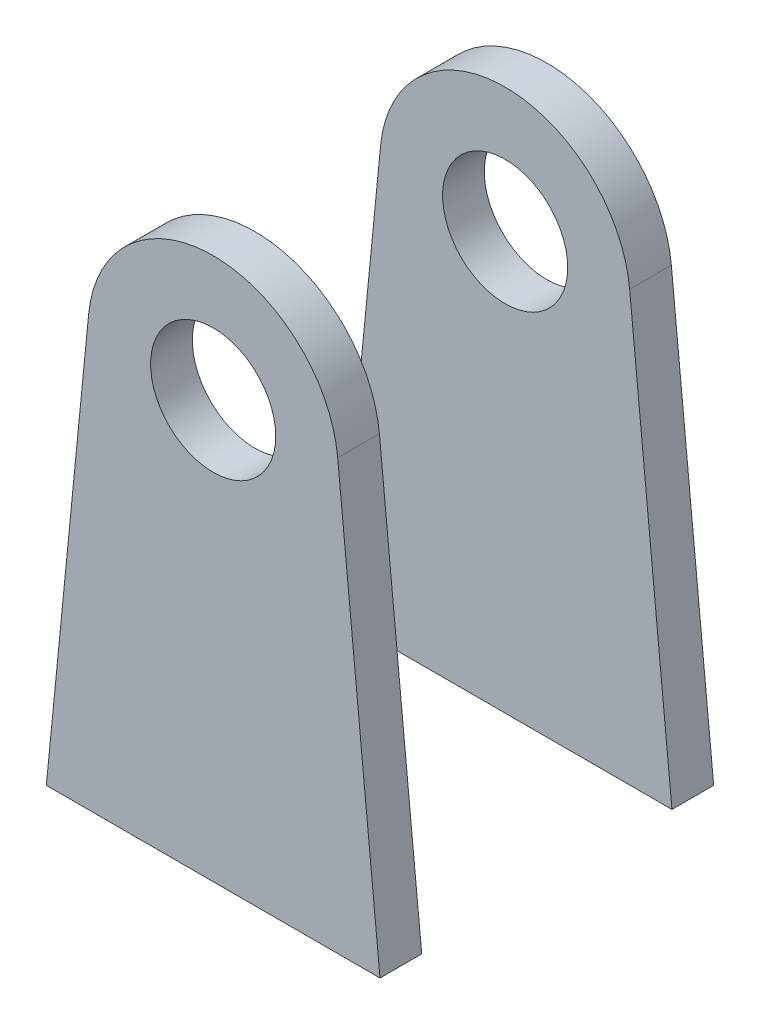
from build123d import *

# Parameters (mm, degrees)
BOSS_EXTRUDE1_START = 12.7
SKETCH1_R           = 4.7625
BOSS_EXTRUDE1_DEPTH = 3.175
BOSS_EXTRUDE2_START = -12.7
SKETCH1_4_R         = 4.7625
BOSS_EXTRUDE2_DEPTH = 3.175


with BuildPart() as part:
    # Sketch1 → Boss-Extrude1 (new body)
    with BuildSketch(Plane.XY.offset(BOSS_EXTRUDE1_START)):
        with BuildLine():
            Line((12.7, -31.75), (9.479083286, 0.934133315))
            ThreePointArc((9.479083286, 0.934133315), (0, 9.525), (-9.479083286, 0.934133315))
            Line((-9.479083286, 0.934133315), (-12.7, -31.75))
            Line((-12.7, -31.75), (12.7, -31.75))
        make_face()
        Circle(SKETCH1_R, mode=Mode.SUBTRACT)
    extrude(amount=-BOSS_EXTRUDE1_DEPTH)


with BuildPart() as body_2:
    # Sketch1<4> → Boss-Extrude2 (new body)
    with BuildSketch(Plane.XY.offset(BOSS_EXTRUDE2_START)):
        with BuildLine():
            Line((12.7, -31.75), (9.479083286, 0.934133315))
            ThreePointArc((9.479083286, 0.934133315), (0, 9.525), (-9.479083286, 0.934133315))
            Line((-9.479083286, 0.934133315), (-12.7, -31.75))
            Line((-12.7, -31.75), (12.7, -31.75))
        make_face()
        Circle(SKETCH1_4_R, mode=Mode.SUBTRACT)
    extrude(amount=BOSS_EXTRUDE2_DEPTH)


solid = Compound([part.part, body_2.part])
